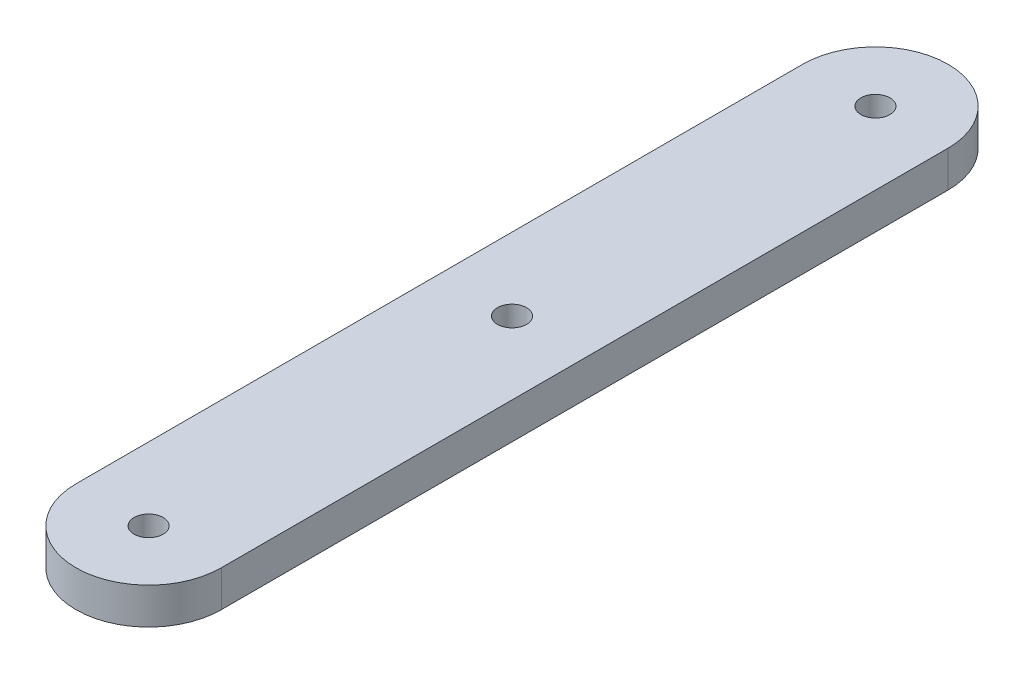
from build123d import *

# Parameters (mm, degrees)
SKETCH2_R           = 1.27
BOSS_EXTRUDE1_DEPTH = 3.175


with BuildPart() as part:
    # Sketch2 → Boss-Extrude1 (new body)
    with BuildSketch(Plane(origin=(0, 0, 0), x_dir=(1, 0, 0), z_dir=(0, 1, 0))):
        with BuildLine():
            Line((-6.35, 31.75), (-6.35, -31.75))
            ThreePointArc((-6.35, -31.75), (0, -38.1), (6.35, -31.75))
            Line((6.35, -31.75), (6.35, 31.75))
            ThreePointArc((6.35, 31.75), (0, 38.1), (-6.35, 31.75))
        make_face()
        with Locations((0, -31.75)):
            Circle(SKETCH2_R, mode=Mode.SUBTRACT)
        Circle(SKETCH2_R, mode=Mode.SUBTRACT)
        with Locations((0, 31.75)):
            Circle(SKETCH2_R, mode=Mode.SUBTRACT)
    extrude(amount=BOSS_EXTRUDE1_DEPTH)


solid = part.part
